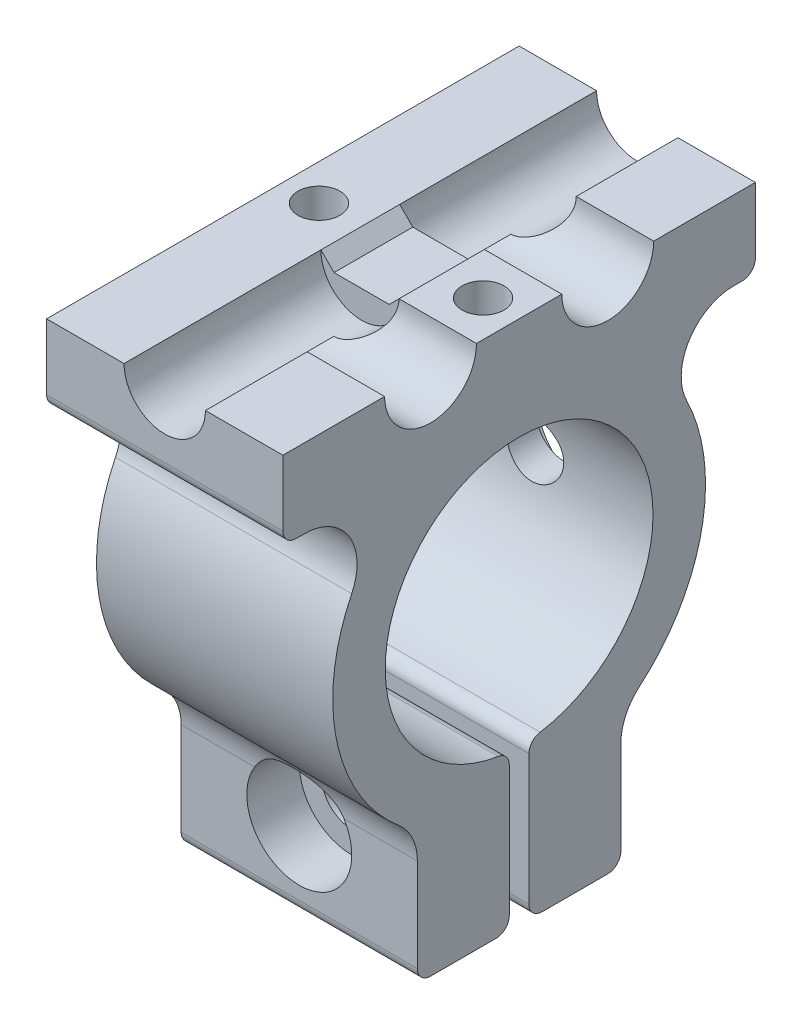
from build123d import *

# Parameters (mm, degrees)
EXTRUDE_1_DEPTH               = 9
CUT_EXTRUDE_1_DEPTH           = 30.816103032
CUT_EXTRUDE_1_DEPTH_BACK      = 30.816103032
SKETCH_2_R                    = 2.3
CUT_EXTRUDE_2_DEPTH           = 3.3
CUT_EXTRUDE_2_OTHER_WAY_DEPTH = 36.043722716
CUT_EXTRUDE_2_OTHER_WAY_TAPER = 1
CUT_EXTRUDE_3_DEPTH           = 36.043722716
CUT_EXTRUDE_3_DEPTH_BACK      = 4
CUT_EXTRUDE_4_REACH           = 46.777
CUT_EXTRUDE_4_END_RADIUS      = 10.2
SKETCH_5_R                    = 1.6
EXTRUDE_2_DEPTH               = 3
SKETCH_7_W                    = 6.2
SKETCH_7_H                    = 6
CUT_EXTRUDE_6_DEPTH           = 1
CHAMFER_3_SIZE                = 1
CUT_EXTRUDE_8_REACH           = 35.645
SKETCH_9_R                    = 2.2
CUT_EXTRUDE_9_DEPTH           = 30.816103122
CUT_EXTRUDE_START             = 5.5
SKETCH_10_R                   = 4
SKETCH_10_R_2                 = 2.2
CUT_EXTRUDE_10_DEPTH          = 5.5


with BuildPart() as part:
    # Эскиз1 → Бобышка-Вытянуть1 (new, symmetric)
    with BuildSketch(Plane(origin=(0, 0, 0), x_dir=(0, 0, -1), z_dir=(1, 0, 0))):
        with BuildLine():
            Line((-0.75, -21), (-0.75, -11.06243644))
            ThreePointArc((-0.75, -11.06243644), (-0.989654684, -10.412917388), (-1.59375, -10.074718901))
            ThreePointArc((-1.59375, -10.074718901), (0, 10.2), (1.59375, -10.074718901))
            ThreePointArc((1.59375, -10.074718901), (0.989654684, -10.412917388), (0.75, -11.06243644))
            Line((0.75, -11.06243644), (0.75, -21))
            ThreePointArc((0.75, -21), (1.042893219, -21.707106781), (1.75, -22))
            Line((1.75, -22), (6.75, -22))
            ThreePointArc((6.75, -22), (7.457106781, -21.707106781), (7.75, -21))
            Line((7.75, -21), (7.75, -13.898830886))
            ThreePointArc((7.75, -13.898830886), (8.121662204, -12.215036114), (9.167582418, -10.844142779))
            ThreePointArc((9.167582418, -10.844142779), (13.897042702, -2.917568189), (12.75462481, 6.241758242))
            ThreePointArc((12.75462481, 6.241758242), (12.953882386, 10.117431577), (16.34747687, 12))
            Line((16.34747687, 12), (17, 12))
            ThreePointArc((17, 12), (17.707106781, 12.292893219), (18, 13))
            Line((18, 13), (18, 18))
            Line((18, 18), (-18, 18))
            Line((-18, 18), (-18, 13))
            ThreePointArc((-18, 13), (-17.707106781, 12.292893219), (-17, 12))
            Line((-17, 12), (-16.34747687, 12))
            ThreePointArc((-16.34747687, 12), (-12.953882386, 10.117431577), (-12.75462481, 6.241758242))
            ThreePointArc((-12.75462481, 6.241758242), (-13.897042702, -2.917568189), (-9.167582418, -10.844142779))
            ThreePointArc((-9.167582418, -10.844142779), (-8.121662204, -12.215036114), (-7.75, -13.898830886))
            Line((-7.75, -13.898830886), (-7.75, -21))
            ThreePointArc((-7.75, -21), (-7.457106781, -21.707106781), (-6.75, -22))
            Line((-6.75, -22), (-1.75, -22))
            ThreePointArc((-1.75, -22), (-1.042893219, -21.707106781), (-0.75, -21))
        make_face()
    extrude(amount=EXTRUDE_1_DEPTH, both=True)

    # Эскиз2 → Вырез-Вытянуть1 (cut, two sides: drawn at the far end of the back side and taken through both)
    with BuildSketch(Plane.XY.offset(-CUT_EXTRUDE_1_DEPTH_BACK)):
        with BuildLine():
            ThreePointArc((-3.1, 18), (0, 14.9), (3.1, 18))
            Line((3.1, 18), (-3.1, 18))
        make_face()
        with Locations(Location((0, -16, 0), (0, 0, 66.000891847))):
            Circle(SKETCH_2_R)
    extrude(amount=CUT_EXTRUDE_1_DEPTH + CUT_EXTRUDE_1_DEPTH_BACK, mode=Mode.SUBTRACT)

    # Эскиз3 → Вырез-Вытянуть2 (cut)
    with BuildSketch(Plane(origin=(0, 0, -7.75), x_dir=(-1, 0, 0), z_dir=(0, 0, -1))):
        Polygon((-4.618802154, -16), (-2.309401077, -20), (2.309401077, -20), (4.618802154, -16), (2.309401077, -12), (-2.309401077, -12), align=None)
    extrude(amount=-CUT_EXTRUDE_2_DEPTH, mode=Mode.SUBTRACT)

    # Эскиз3 → Вырез-Вытянуть2 other way (cut)
    with BuildSketch(Plane(origin=(0, 0, -7.75), x_dir=(-1, 0, 0), z_dir=(0, 0, -1))):
        Polygon((-4.618802154, -16), (-2.309401077, -20), (2.309401077, -20), (4.618802154, -16), (2.309401077, -12), (-2.309401077, -12), align=None)
    extrude(amount=CUT_EXTRUDE_2_OTHER_WAY_DEPTH, taper=CUT_EXTRUDE_2_OTHER_WAY_TAPER, mode=Mode.SUBTRACT)

    # Эскиз4 → Вырез-Вытянуть3 (cut, two sides: drawn at the far end of the back side and taken through both)
    with BuildSketch(Plane.XY.offset(7.75).offset(-CUT_EXTRUDE_3_DEPTH_BACK)):
        with BuildLine():
            Line((-3.403687464, -13.898830886), (-0.935461573, -13.898830886))
            ThreePointArc((-0.935461573, -13.898830886), (0, -18.3), (0.935461573, -13.898830886))
            Line((0.935461573, -13.898830886), (3.403687464, -13.898830886))
            ThreePointArc((3.403687464, -13.898830886), (0, -12), (-3.403687464, -13.898830886))
        make_face()
        with BuildLine():
            ThreePointArc((0.935461573, -13.898830886), (0, -18.3), (-0.935461573, -13.898830886))
            Line((-0.935461573, -13.898830886), (-3.403687464, -13.898830886))
            ThreePointArc((-3.403687464, -13.898830886), (-1.092073748, -19.848035204), (4, -16))
            ThreePointArc((4, -16), (3.848035204, -14.907926252), (3.403687464, -13.898830886))
            Line((3.403687464, -13.898830886), (0.935461573, -13.898830886))
        make_face()
        with BuildLine():
            Line((-3.403687464, -13.898830886), (-0.935461573, -13.898830886))
            ThreePointArc((-0.935461573, -13.898830886), (0, -18.3), (0.935461573, -13.898830886))
            Line((0.935461573, -13.898830886), (3.403687464, -13.898830886))
            ThreePointArc((3.403687464, -13.898830886), (0, -12), (-3.403687464, -13.898830886))
        make_face()
        with BuildLine():
            ThreePointArc((0.935461573, -13.898830886), (0, -18.3), (-0.935461573, -13.898830886))
            Line((-0.935461573, -13.898830886), (-3.403687464, -13.898830886))
            ThreePointArc((-3.403687464, -13.898830886), (-1.092073748, -19.848035204), (4, -16))
            ThreePointArc((4, -16), (3.848035204, -14.907926252), (3.403687464, -13.898830886))
            Line((3.403687464, -13.898830886), (0.935461573, -13.898830886))
        make_face()
    extrude(amount=CUT_EXTRUDE_3_DEPTH + CUT_EXTRUDE_3_DEPTH_BACK, mode=Mode.SUBTRACT)

    # Вырез-Вытянуть4: up to this cylinder (the profile starts outside it)
    cut_extrude_4_end = Plane(origin=(0, 0, 0), z_dir=(-1, 0, 0)) * Cylinder(CUT_EXTRUDE_4_END_RADIUS, 127.454, mode=Mode.PRIVATE)
    # Эскиз5 → Вырез-Вытянуть4 (cut, up to the surface)
    with BuildSketch(Plane(origin=(0, 18, 0), x_dir=(1, 0, 0), z_dir=(0, 1, 0)), mode=Mode.PRIVATE) as cut_extrude_4_sk1:
        with Locations(Location((6.25, 0, 0), (0, 0, 270))):
            Circle(SKETCH_5_R)
    cut_extrude_4_tool1 = extrude(cut_extrude_4_sk1.sketch, amount=-CUT_EXTRUDE_4_REACH, mode=Mode.PRIVATE) - cut_extrude_4_end
    add(cut_extrude_4_tool1.solids().sort_by_distance((6.25, 18, 0))[0], mode=Mode.SUBTRACT)
    # Эскиз5 → Вырез-Вытянуть4 (cut, up to the surface)
    with BuildSketch(Plane(origin=(0, 18, 0), x_dir=(1, 0, 0), z_dir=(0, 1, 0)), mode=Mode.PRIVATE) as cut_extrude_4_sk2:
        with Locations(Location((-6.25, 0, 0), (0, 0, 270))):
            Circle(SKETCH_5_R)
    cut_extrude_4_tool2 = extrude(cut_extrude_4_sk2.sketch, amount=-CUT_EXTRUDE_4_REACH, mode=Mode.PRIVATE) - cut_extrude_4_end
    add(cut_extrude_4_tool2.solids().sort_by_distance((-6.25, 18, 0))[0], mode=Mode.SUBTRACT)

    # Эскиз6 → Бобышка-Вытянуть2 (add, symmetric)
    with BuildSketch(Plane.XY):
        with BuildLine():
            Line((-3.1, 18), (3.1, 18))
            ThreePointArc((3.1, 18), (0, 14.9), (-3.1, 18))
        make_face()
    extrude(amount=EXTRUDE_2_DEPTH, both=True)

    # Эскиз7 → Вырез-Вытянуть6 (cut)
    with BuildSketch(Plane(origin=(0, 18, 0), x_dir=(1, 0, 0), z_dir=(0, 1, 0))):
        Rectangle(SKETCH_7_W, SKETCH_7_H)
    extrude(amount=-CUT_EXTRUDE_6_DEPTH, mode=Mode.SUBTRACT)

    # Фаска3
    # the kernel refuses this chamfer: 1 mm, written as the material it adds along each edge
    with BuildSketch(Plane(origin=(3.1, 17, -3), x_dir=(0.02749587661058651, 0.9996219169112968, 0), z_dir=(0, 0, 1))) as chamfer_3_piece_1_section:
        Polygon((CHAMFER_3_SIZE * 0.999621916911, CHAMFER_3_SIZE * 0.0274958766106), (-CHAMFER_3_SIZE * 0.0274958766106, CHAMFER_3_SIZE * 0.999621916911), (0, 0), align=None)
    chamfer_3_piece_1 = extrude(amount=6, mode=Mode.PRIVATE)
    chamfer_3_piece_1 = split(chamfer_3_piece_1, bisect_by=Plane(origin=(2.769595846, 18, 0), z_dir=(0, -1, 0)), keep=Keep.TOP, mode=Mode.PRIVATE)
    add(chamfer_3_piece_1)
    with BuildSketch(Plane(origin=(-3.1, 17, 3), x_dir=(-0.02749587661058651, 0.9996219169112968, 0), z_dir=(0, 0, -1))) as chamfer_3_piece_2_section:
        Polygon((CHAMFER_3_SIZE * 0.999621916911, CHAMFER_3_SIZE * 0.0274958766106), (-CHAMFER_3_SIZE * 0.0274958766106, CHAMFER_3_SIZE * 0.999621916911), (0, 0), align=None)
    chamfer_3_piece_2 = extrude(amount=6, mode=Mode.PRIVATE)
    chamfer_3_piece_2 = split(chamfer_3_piece_2, bisect_by=Plane(origin=(-2.769595846, 18, 0), z_dir=(0, -1, 0)), keep=Keep.TOP, mode=Mode.PRIVATE)
    add(chamfer_3_piece_2)

    # Вырез-Вытянуть8: up to this plane
    cut_extrude_8_end = Plane(origin=(3.1, 18, 0), z_dir=(-0.7071067811865525, 0.7071067811865426, 0))
    # Эскиз8 → Вырез-Вытянуть8 (cut, up to the surface)
    with BuildSketch(Plane(origin=(9, 0, 0), x_dir=(0, 0, -1), z_dir=(1, 0, 0)), mode=Mode.PRIVATE) as cut_extrude_8_sk1:
        with BuildLine():
            ThreePointArc((-10.25, 18), (-6.75, 14.5), (-3.25, 18))
            Line((-3.25, 18), (-10.25, 18))
        make_face()
    cut_extrude_8_tool1 = split(extrude(cut_extrude_8_sk1.sketch, amount=-CUT_EXTRUDE_8_REACH, mode=Mode.PRIVATE), bisect_by=cut_extrude_8_end, keep=Keep.BOTH, mode=Mode.PRIVATE)
    add(cut_extrude_8_tool1.solids().sort_by_distance((9, 16.514554, 6.75))[0], mode=Mode.SUBTRACT)
    # Эскиз8 → Вырез-Вытянуть8 (cut, up to the surface)
    with BuildSketch(Plane(origin=(9, 0, 0), x_dir=(0, 0, -1), z_dir=(1, 0, 0)), mode=Mode.PRIVATE) as cut_extrude_8_sk2:
        with BuildLine():
            ThreePointArc((3.25, 18), (6.75, 14.5), (10.25, 18))
            Line((10.25, 18), (3.25, 18))
        make_face()
    cut_extrude_8_tool2 = split(extrude(cut_extrude_8_sk2.sketch, amount=-CUT_EXTRUDE_8_REACH, mode=Mode.PRIVATE), bisect_by=cut_extrude_8_end, keep=Keep.BOTH, mode=Mode.PRIVATE)
    add(cut_extrude_8_tool2.solids().sort_by_distance((9, 16.514554, -6.75))[0], mode=Mode.SUBTRACT)

    # Эскиз9 → Вырез-Вытянуть9 (cut, through all)
    with BuildSketch(Plane.XY):
        Circle(SKETCH_9_R)
    extrude(amount=-CUT_EXTRUDE_9_DEPTH, mode=Mode.SUBTRACT)

    # Эскиз10 → Вырез-Вытянуть10 (cut)
    with BuildSketch(Plane.XY.offset(-18).offset(CUT_EXTRUDE_START)):
        with Locations(Location((0, 0, 0), (0, 0, 180))):
            Circle(SKETCH_10_R)
        Circle(SKETCH_10_R_2, mode=Mode.SUBTRACT)
    extrude(amount=-CUT_EXTRUDE_10_DEPTH, mode=Mode.SUBTRACT)


solid = part.part
